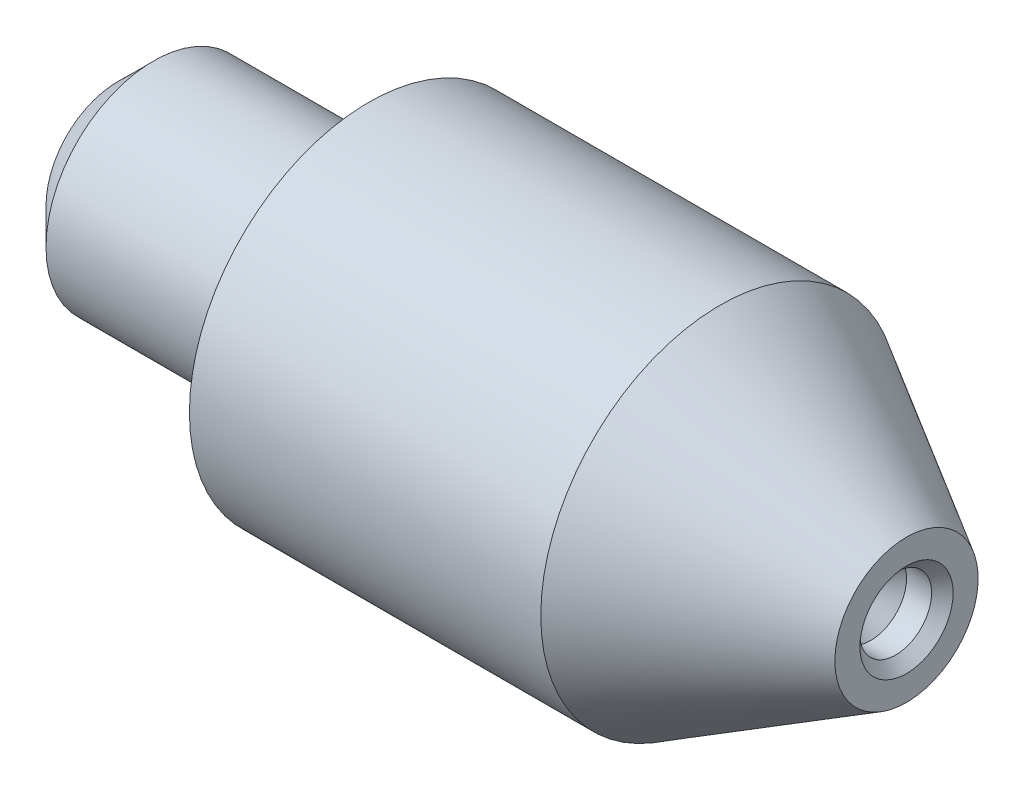
from build123d import *

# Parameters (mm, degrees)
SKETCH2_R          = 1
CUT_EXTRUDE1_DEPTH = 0.3
CHAMFER1_SIZE      = 0.3
SKETCH3_R          = 1
CUT_EXTRUDE2_DEPTH = 0.7


with BuildPart() as part:
    # Sketch1 → Revolve1 (revolve)
    with BuildSketch(Plane(origin=(0, 0, 0), x_dir=(1, 0, 0), z_dir=(0, 1, 0)), mode=Mode.PRIVATE) as revolve1_sk:
        Polygon((-7, 0), (-7, 2), (-6, 3), (0, 3), (0, 5), (9.8, 5), (15, 1.9977786), (15, 0), align=None)
    revolve(revolve1_sk.sketch.rotate(Axis((-2.845265589, 0, 0), (1, 0, 0)), 180), axis=Axis((-2.845265589, 0, 0), (1, 0, 0)))

    # Sketch2 → Cut-Extrude1 (cut)
    with BuildSketch(Plane(origin=(15, 0, 0), x_dir=(0, 0, -1), z_dir=(1, 0, 0))):
        Circle(SKETCH2_R)
    extrude(amount=-CUT_EXTRUDE1_DEPTH, mode=Mode.SUBTRACT)

    # Chamfer1
    chamfer1_edges = [part.edges().sort_by_distance(p)[0] for p in [
        (15, 0, 1),
    ]]
    chamfer(chamfer1_edges, length=CHAMFER1_SIZE - 0.0001)  # a hair under: the kernel refuses the full size

    # Sketch3 → Cut-Extrude2 (cut)
    with BuildSketch(Plane(origin=(14.7, 0, 0), x_dir=(0, 0, -1), z_dir=(1, 0, 0))):
        Circle(SKETCH3_R)
    extrude(amount=-CUT_EXTRUDE2_DEPTH, mode=Mode.SUBTRACT)

    # Cut-Extrude3 cone 1 section (through the dimple's axis) → Cut-Extrude3 (revolve, cut)
    with BuildSketch(Plane(origin=(14, 0, 0), x_dir=(0, 0, -1), z_dir=(0, 1, 0))):
        Polygon((0, 0), (1, 0), (0, 1), align=None)
    revolve(axis=Axis((14, 0, 0), (-1, 0, 0)), mode=Mode.SUBTRACT)


solid = part.part
